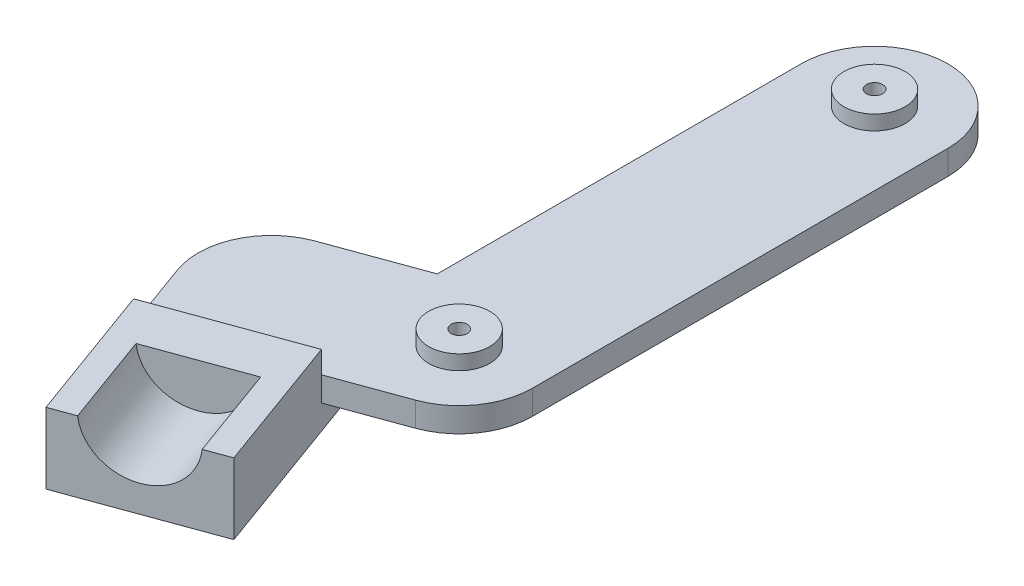
from build123d import *

# Parameters (mm, degrees)
EXTRUDE_1_DEPTH        = 5
SKETCH_2_R             = 6.25
EXTRUDE_2_DEPTH        = 3
HOLE_WIZARD_M4_1_D     = 3.3
HOLE_WIZARD_M4_1_DEPTH = 5
HOLE_WIZARD_M4_1_TIP   = 0.991420021
EXTRUDE_3_DEPTH        = 5
EXTRUDE_4_DEPTH        = 5
EXTRUDE_4_DEPTH_BACK   = 5
EXTRUDE_5_DEPTH        = 4.5
SKETCH_12_R            = 10
CUT_EXTRUDE_1_DEPTH    = 20


with BuildPart() as part:
    # 스케치1 → 보스-돌출1 (new body)
    with BuildSketch(Plane(origin=(0, 0, 0), x_dir=(1, 0, 0), z_dir=(0, 1, 0))):
        with BuildLine():
            Line((-15, 0), (-15, 85))
            ThreePointArc((-15, 85), (0, 100), (15, 85))
            Line((15, 85), (15, 0))
            ThreePointArc((15, 0), (0, -15), (-15, 0))
        make_face()
    extrude(amount=EXTRUDE_1_DEPTH)

    # 스케치2 → 보스-돌출2 (add)
    with BuildSketch(Plane(origin=(0, 5, 0), x_dir=(1, 0, 0), z_dir=(0, 1, 0))):
        with Locations((0, 85)):
            Circle(SKETCH_2_R)
        Circle(SKETCH_2_R)
    extrude(amount=EXTRUDE_2_DEPTH)

    # M4 탭을 위한 탭 드릴1
    with Locations(Plane(origin=(0, 8, 0), x_dir=(1, 0, 0), z_dir=(0, 1, 0))):
        with Locations((0, 0), (0, 85)):
            Hole(HOLE_WIZARD_M4_1_D / 2, depth=HOLE_WIZARD_M4_1_DEPTH)
            with Locations((0, 0, -(HOLE_WIZARD_M4_1_DEPTH + HOLE_WIZARD_M4_1_TIP / 2))):  # 118° drill point
                Cone(0, HOLE_WIZARD_M4_1_D / 2, HOLE_WIZARD_M4_1_TIP, mode=Mode.SUBTRACT)

    # 스케치9 → 보스-돌출3 (add)
    with BuildSketch(Plane.XZ):
        with BuildLine():
            Line((-5.13030215, -14.095389312), (-33.321080773, -3.834785012))
            ThreePointArc((-33.321080773, -3.834785012), (-42.286167935, 15.39090645), (-23.060476474, 24.355993612))
            Line((-23.060476474, 24.355993612), (5.13030215, 14.095389312))
            ThreePointArc((5.13030215, 14.095389312), (14.095389312, -5.13030215), (-5.13030215, -14.095389312))
        make_face()
    extrude(amount=-EXTRUDE_3_DEPTH)

    # 스케치10 → 보스-돌출4 (add, two sides: drawn at the far end of the back side and taken through both)
    with BuildSketch(Plane.XZ.offset(-EXTRUDE_4_DEPTH_BACK)):
        with BuildLine():
            Line((-42.286167935, 15.39090645), (-26.895261486, 57.677074385))
            Line((-26.895261486, 57.677074385), (1.295517138, 47.416470085))
            Line((1.295517138, 47.416470085), (-14.095389312, 5.13030215))
            ThreePointArc((-14.095389312, 5.13030215), (-33.321080773, -3.834785012), (-42.286167935, 15.39090645))
        make_face()
    extrude(amount=EXTRUDE_4_DEPTH + EXTRUDE_4_DEPTH_BACK)

    # 스케치11 → 보스-돌출5 (add)
    with BuildSketch(Plane(origin=(0, 5, 0), x_dir=(1, 0, 0), z_dir=(0, 1, 0))):
        Polygon((-26.895261486, -57.677074385), (-37.155865785, -29.486295761), (-8.965087162, -19.225691462), (1.295517138, -47.416470085), align=None)
    extrude(amount=EXTRUDE_5_DEPTH)

    # 스케치12 → 컷-돌출1 (cut)
    with BuildSketch(Plane(origin=(15.39090645, 0, 42.286167935), x_dir=(0.9396926207859109, 0, -0.342020143325662), z_dir=(0.342020143325662, 0, 0.9396926207859109))):
        with Locations((-30, 10.5)):
            Circle(SKETCH_12_R)
    extrude(amount=-CUT_EXTRUDE_1_DEPTH, mode=Mode.SUBTRACT)


solid = part.part
